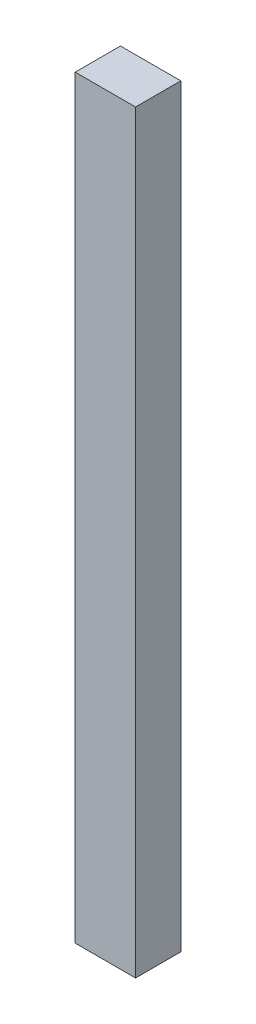
from build123d import *

# Parameters (mm, degrees)
SKETCH1_W           = 40
SKETCH1_H           = 500
BOSS_EXTRUDE1_DEPTH = 30


with BuildPart() as part:
    # Sketch1 → Boss-Extrude1 (new body)
    with BuildSketch(Plane.XY):
        Rectangle(SKETCH1_W, SKETCH1_H)
    extrude(amount=BOSS_EXTRUDE1_DEPTH)


solid = part.part
